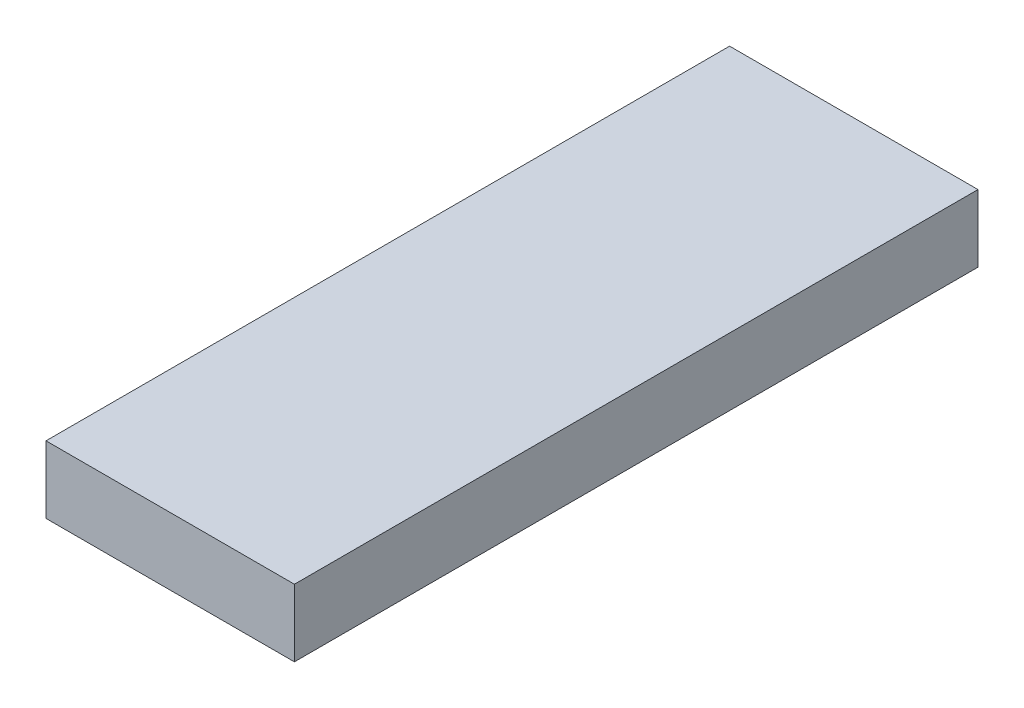
from build123d import *

# Parameters (mm, degrees)
SKETCH1_W           = 11.08326926
SKETCH1_H           = 3
BOSS_EXTRUDE1_DEPTH = 15.25


with BuildPart() as part:
    # Sketch1 → Boss-Extrude1 (new, symmetric)
    with BuildSketch(Plane.XY):
        with Locations((0, 54.225131544)):
            Rectangle(SKETCH1_W, SKETCH1_H)
    extrude(amount=BOSS_EXTRUDE1_DEPTH, both=True)


solid = part.part
